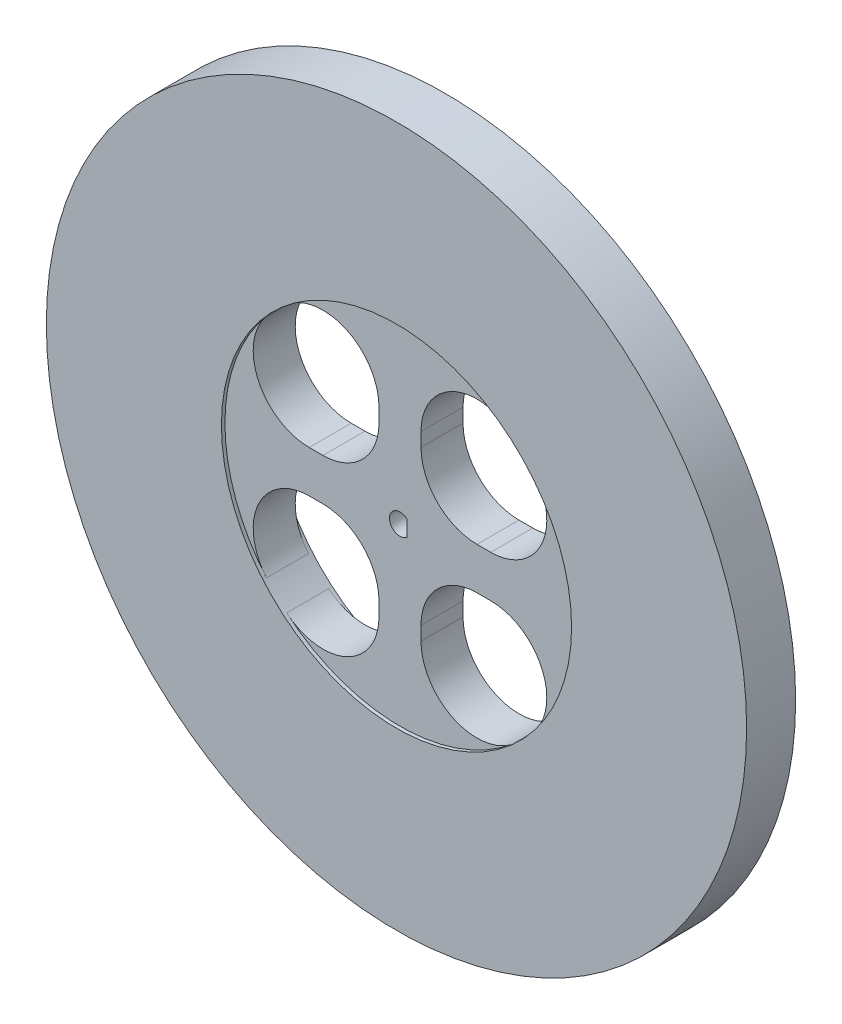
from build123d import *

# Parameters (mm, degrees)
SKETCH4_W                = 25
SKETCH4_H                = 7
BOSS_EXTRUDE3_DEPTH      = 3
BOSS_EXTRUDE3_DEPTH_BACK = 3
FILLET2_R                = 8
CUT_EXTRUDE1_REACH       = 73.009


with BuildPart() as part:
    # Sketch4 → Revolve2 (revolve)
    with BuildSketch(Plane(origin=(0, 0, 0), x_dir=(1, 0, 0), z_dir=(0, 1, 0))):
        with Locations((37.5, 0)):
            Rectangle(SKETCH4_W, SKETCH4_H)
    revolve(axis=Axis((0, 0, -11.674254949), (0, 0, 1)))

    # Sketch5 → Boss-Extrude3 (add, two sides: drawn at the far end of the back side and taken through both)
    with BuildSketch(Plane.XY.offset(-BOSS_EXTRUDE3_DEPTH_BACK)):
        with BuildLine():
            Line((-3, 24.819347292), (-3, 3))
            Line((-3, 3), (-24.819347292, 3))
            ThreePointArc((-24.819347292, 3), (-25, 0), (-24.819347292, -3))
            Line((-24.819347292, -3), (-3, -3))
            Line((-3, -3), (-3, -24.819347292))
            ThreePointArc((-3, -24.819347292), (0, -25), (3, -24.819347292))
            Line((3, -24.819347292), (3, -3))
            Line((3, -3), (24.819347292, -3))
            ThreePointArc((24.819347292, -3), (25, 0), (24.819347292, 3))
            Line((24.819347292, 3), (3, 3))
            Line((3, 3), (3, 24.819347292))
            ThreePointArc((3, 24.819347292), (0, 25), (-3, 24.819347292))
        make_face()
    extrude(amount=BOSS_EXTRUDE3_DEPTH + BOSS_EXTRUDE3_DEPTH_BACK)

    # Fillet2
    fillet2_edges = [part.edges().sort_by_distance(p)[0] for p in [
        (3, -3, 0),
        (-3, -3, 0),
        (-3, 3, 0),
        (3, 3, 0),
        (-3, 24.819347292, 0),
        (3, 24.819347292, 0),
        (24.819347292, -3, 0),
        (24.819347292, 3, 0),
        (-3, -24.819347292, 0),
        (3, -24.819347292, 0),
        (-24.819347292, 3, 0),
        (-24.819347292, -3, 0),
    ]]
    fillet(fillet2_edges, radius=FILLET2_R)

    # Sketch6 → Cut-Extrude1 (cut, up to next)
    with BuildSketch(Plane.XY.offset(3), mode=Mode.PRIVATE) as cut_extrude1_sk1:
        with BuildLine():
            Line((1, 1.118033989), (1, -1.118033989))
            ThreePointArc((1, -1.118033989), (-1.5, 0), (1, 1.118033989))
        make_face()
    cut_extrude1_tool1 = extrude(cut_extrude1_sk1.sketch, amount=-CUT_EXTRUDE1_REACH, mode=Mode.PRIVATE) & part.part
    add(cut_extrude1_tool1.solids().sort_by_distance((-0.148024, 0, 3))[0], mode=Mode.SUBTRACT)


solid = part.part
